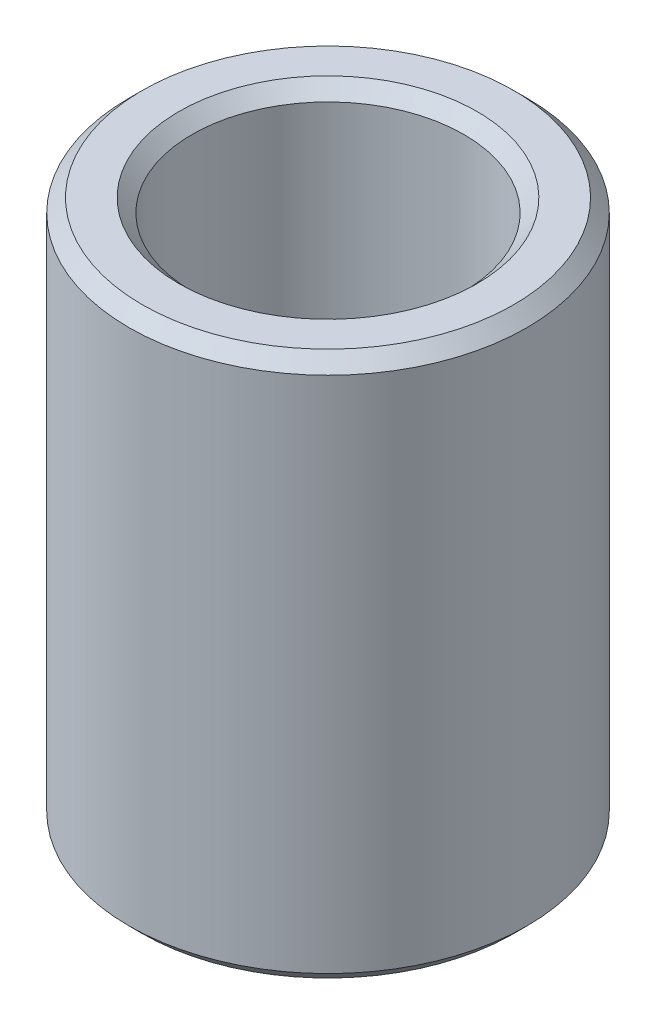
from build123d import *

# Parameters (mm, degrees)
SKETCH1_R           = 57.5
BOSS_EXTRUDE1_DEPTH = 157.454296837
SKETCH2_R           = 39.280757216
CUT_EXTRUDE1_DEPTH  = 178.212741056
CHAMFER1_SIZE       = 3.828413195


with BuildPart() as part:
    # Sketch1 → Boss-Extrude1 (new body)
    with BuildSketch(Plane(origin=(0, 0, 0), x_dir=(1, 0, 0), z_dir=(0, 1, 0))):
        Circle(SKETCH1_R)
    extrude(amount=BOSS_EXTRUDE1_DEPTH)

    # Sketch2 → Cut-Extrude1 (cut, through all)
    with BuildSketch(Plane(origin=(0, 0, 0), x_dir=(1, 0, 0), z_dir=(0, 1, 0))):
        Circle(SKETCH2_R)
    extrude(amount=CUT_EXTRUDE1_DEPTH, mode=Mode.SUBTRACT)

    # Chamfer1
    chamfer1_edges = [part.edges().sort_by_distance(p)[0] for p in [
        (-39.280757216, 157.454296837, 0),
        (-39.280757216, 0, 0),
        (-57.5, 0, 0),
        (-57.5, 157.454296837, 0),
    ]]
    chamfer(chamfer1_edges, length=CHAMFER1_SIZE)


solid = part.part
